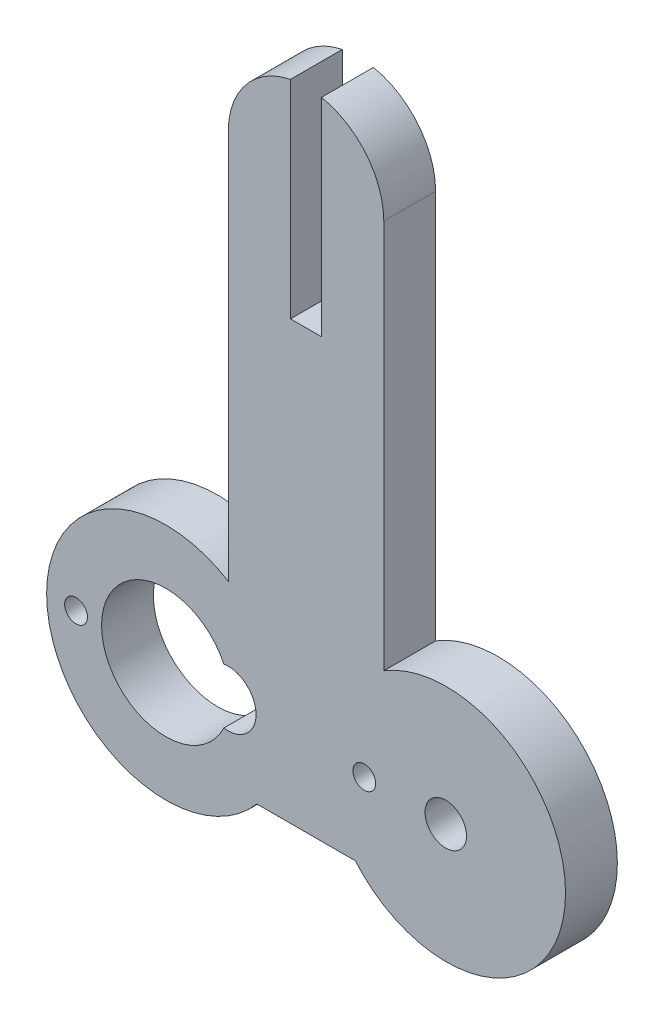
from build123d import *

# Parameters (mm, degrees)
SKETCH3_R           = 1.1
BOSS_EXTRUDE1_DEPTH = 5
SKETCH5_R           = 2
CUT_EXTRUDE1_DEPTH  = 10


with BuildPart() as part:
    # Sketch3 → Boss-Extrude1 (new body)
    with BuildSketch(Plane.XY):
        with BuildLine():
            ThreePointArc((21.010133, 56.127810971), (3.63133679, 44.514906989), (23.766391, 38.905835))
            Line((23.766391, 38.905835), (33.206061, 38.905835))
            Line((33.206061, 38.905835), (33.264681316, 38.905835))
            ThreePointArc((33.264681316, 38.905835), (53.399016999, 44.544189703), (36.010134, 56.154928922))
            Line((36.010134, 56.154928922), (36.010134, 56.158016))
            Line((36.010134, 56.158016), (36.010134, 93.713691502))
            ThreePointArc((36.010134, 93.713691502), (34.319609023, 98.457108027), (30.010134, 101.062160821))
            Line((30.010134, 101.062160821), (30.010134, 101.052906355))
            Line((30.010134, 101.052906355), (30.010134, 81.052906536))
            Line((30.010134, 81.052906536), (27.010134, 81.052906536))
            Line((27.010134, 81.052906536), (27.010134, 101.052906536))
            Line((27.010134, 101.052906536), (27.010134, 101.062160866))
            ThreePointArc((27.010134, 101.062160866), (22.700658897, 98.4571082), (21.010133, 93.713692))
            Line((21.010133, 93.713692), (21.010133, 56.128782))
            Line((21.010133, 56.128782), (21.010133, 56.127810971))
        make_face()
        with Locations((6.326226, 46.332725)):
            Circle(SKETCH3_R, mode=Mode.SUBTRACT)
        with BuildLine():
            ThreePointArc((20.582059495, 43.663146925), (8.78622584, 46.332725409), (20.582059481, 49.002303953))
            ThreePointArc((20.582059481, 49.002303953), (23.686226, 46.332725447), (20.582059495, 43.663146925))
        make_face(mode=Mode.SUBTRACT)
        with Locations((34.126226, 46.332725)):
            Circle(SKETCH3_R, mode=Mode.SUBTRACT)
    extrude(amount=BOSS_EXTRUDE1_DEPTH)

    # Sketch5 → Cut-Extrude1 (cut)
    with BuildSketch(Plane.XY.offset(5)):
        with Locations((41.986225603, 46.332725741)):
            Circle(SKETCH5_R)
    extrude(amount=-CUT_EXTRUDE1_DEPTH, mode=Mode.SUBTRACT)


solid = part.part
